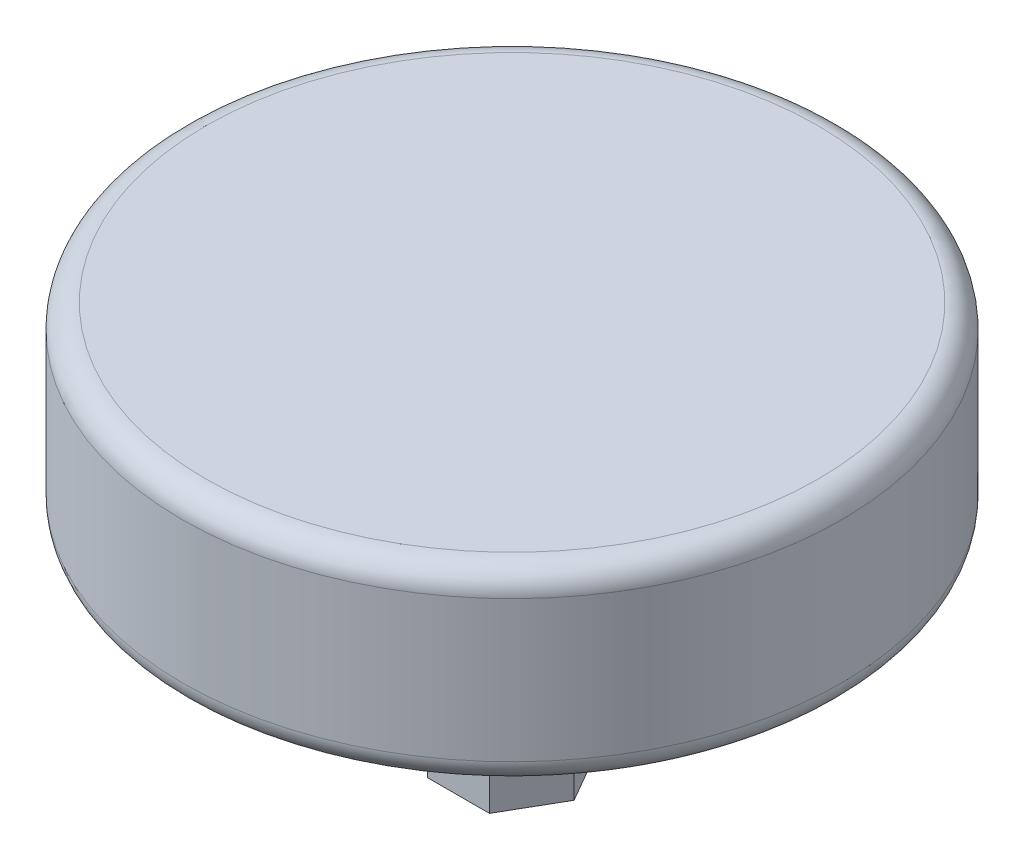
from build123d import *

# Parameters (mm, degrees)
BOSS_EXTRUDE1_DEPTH = 1.75
BOSS_EXTRUDE2_DEPTH = 0.5
BOSS_EXTRUDE5_DEPTH = 3.5
SKETCH4_R           = 3.5
BOSS_EXTRUDE7_DEPTH = 2
SKETCH11_R          = 4.505443821
SKETCH11_R_2        = 3.5
CUT_EXTRUDE3_DEPTH  = 2
SKETCH12_R          = 3.5
CUT_EXTRUDE4_DEPTH  = 3
FILLET2_R           = 1
FILLET3_R           = 0.25


with BuildPart() as part:
    # Sketch1 → Boss-Extrude1 (new body)
    with BuildSketch(Plane(origin=(0, 0, 0), x_dir=(1, 0, 0), z_dir=(0, 1, 0))):
        Polygon((0.658179307, 0), (0.329089653, 0.57), (-0.329089653, 0.57), (-0.658179307, 0), (-0.329089653, -0.57), (0.329089653, -0.57), align=None)
    extrude(amount=BOSS_EXTRUDE1_DEPTH)

    # Sketch2 → Boss-Extrude2 (add)
    with BuildSketch(Plane(origin=(0, 1.75, 0), x_dir=(1, 0, 0), z_dir=(0, 1, 0))):
        Polygon((0, 0.197762982), (0, -0.198641554), (4.375, 0), align=None)
    extrude(amount=BOSS_EXTRUDE2_DEPTH)

    # Sketch3 → Boss-Extrude5 (add)
    with BuildSketch(Plane(origin=(0, 1.75, 0), x_dir=(1, 0, 0), z_dir=(0, 1, 0))):
        Polygon((0.658179307, 0), (0.329089653, 0.57), (-0.329089653, 0.57), (-0.658179307, 0), (-0.329089653, -0.57), (0.329089653, -0.57), align=None)
    extrude(amount=BOSS_EXTRUDE5_DEPTH)

    # Sketch4 → Boss-Extrude7 (add)
    with BuildSketch(Plane(origin=(0, 5.25, 0), x_dir=(1, 0, 0), z_dir=(0, 1, 0))):
        Circle(SKETCH4_R)
    extrude(amount=BOSS_EXTRUDE7_DEPTH)

    # Sketch11 → Cut-Extrude3 (cut)
    with BuildSketch(Plane(origin=(0, 1.75, 0), x_dir=(-1, 0, 0), z_dir=(0, -1, 0))):
        Circle(SKETCH11_R)
        Circle(SKETCH11_R_2, mode=Mode.SUBTRACT)
    extrude(amount=-CUT_EXTRUDE3_DEPTH, mode=Mode.SUBTRACT)

    # Sketch12 → Cut-Extrude4 (cut)
    with BuildSketch(Plane(origin=(0, 0, 0), x_dir=(-1, 0, 0), z_dir=(0, -1, 0))):
        Circle(SKETCH12_R)
    extrude(amount=-CUT_EXTRUDE4_DEPTH, mode=Mode.SUBTRACT)

    # Fillet2
    fillet2_edges = [part.edges().sort_by_distance(p)[0] for p in [
        (-0.49363448, 5.25, -0.285),
        (0, 5.25, -0.57),
        (0.49363448, 5.25, -0.285),
        (0.49363448, 5.25, 0.285),
        (-0.49363448, 5.25, 0.285),
        (0, 5.25, 0.57),
    ]]
    fillet(fillet2_edges, radius=FILLET2_R)

    # Fillet3
    fillet3_edges = [part.edges().sort_by_distance(p)[0] for p in [
        (-3.5, 7.25, 0),
        (-3.5, 5.25, 0),
    ]]
    fillet(fillet3_edges, radius=FILLET3_R)


solid = part.part
